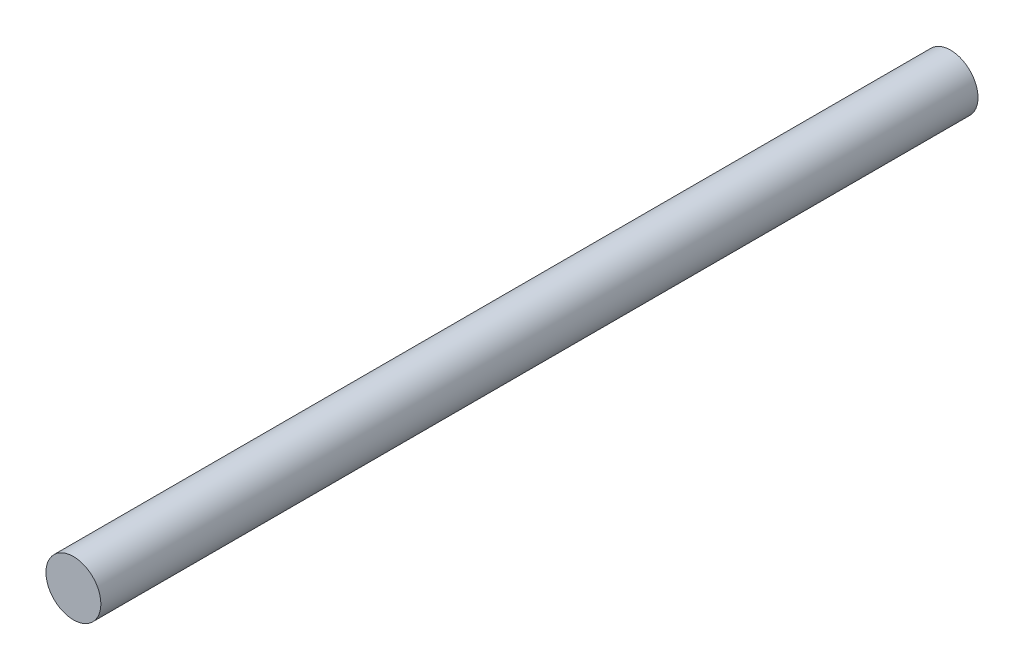
from build123d import *

# Parameters (mm, degrees)
SKETCH_1_R      = 6.260668565
EXTRUDE_1_DEPTH = 200


with BuildPart() as part:
    # 草图1 → 凸台-拉伸1 (new body)
    with BuildSketch(Plane.XY):
        Circle(SKETCH_1_R)
    extrude(amount=EXTRUDE_1_DEPTH)


solid = part.part
